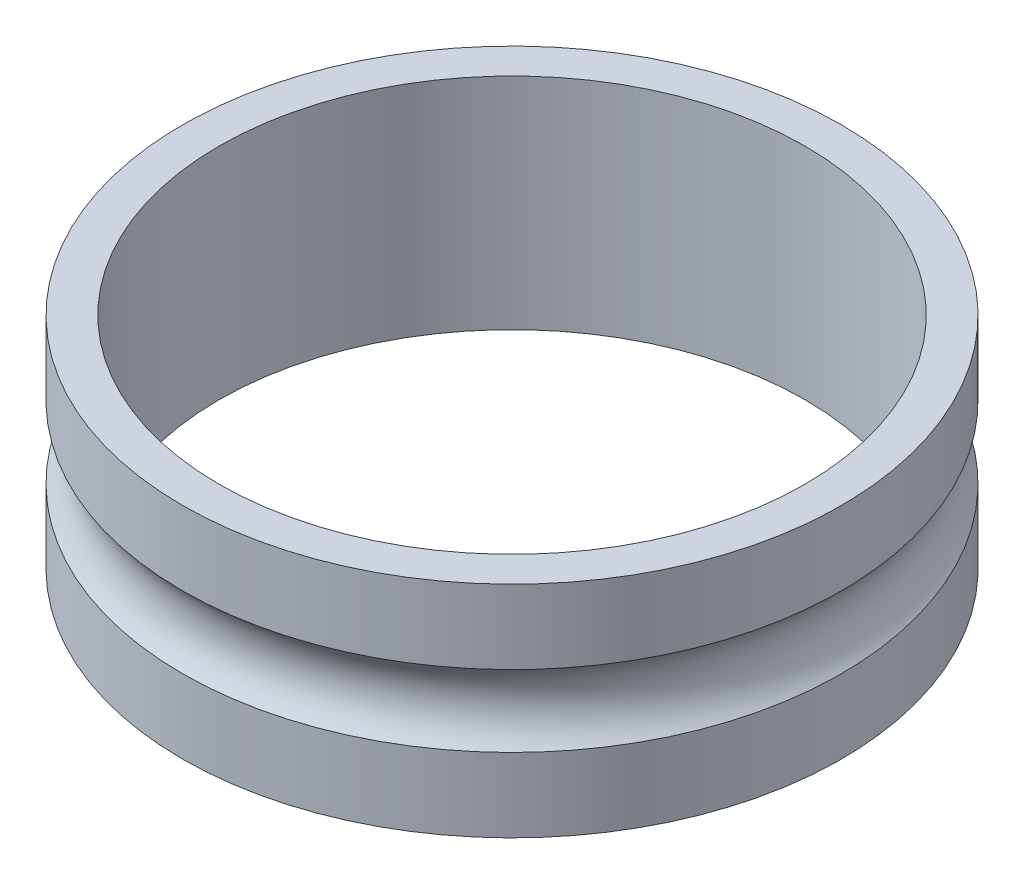
from build123d import *

# Parameters (mm, degrees)
DIAMETER_PROFILE_SKETCH_R     = 4.5
DIAMETER_PROFILE_SKETCH_R_2   = 4
DIAMETER_PROFILE_DEPTH        = 1.5
BEARING_PATH_PROFILE_SKETCH_R = 0.7


with BuildPart() as part:
    # Diameter Profile Sketch → Diameter Profile (new, symmetric)
    with BuildSketch(Plane(origin=(0, 0, 0), x_dir=(1, 0, 0), z_dir=(0, 1, 0))):
        Circle(DIAMETER_PROFILE_SKETCH_R)
        Circle(DIAMETER_PROFILE_SKETCH_R_2, mode=Mode.SUBTRACT)
    extrude(amount=DIAMETER_PROFILE_DEPTH, both=True)

    # Bearing Path Profile Sketch → Bearing Path Profile (revolve, cut)
    with BuildSketch(Plane.XY):
        with Locations((5, 0)):
            Circle(BEARING_PATH_PROFILE_SKETCH_R)
    revolve(axis=Axis((0, 1.5, 0), (0, -1, 0)), mode=Mode.SUBTRACT)


solid = part.part
